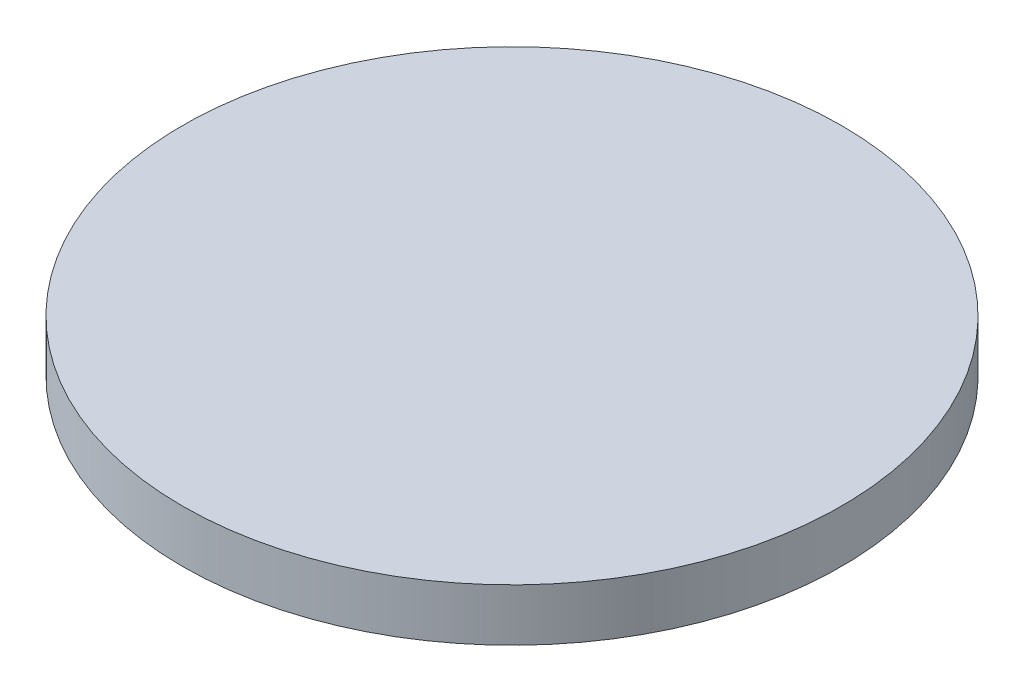
from build123d import *

# Parameters (mm, degrees)
ESQUISSE1_R        = 40
BOSS_EXTRU_1_DEPTH = 6.35


with BuildPart() as part:
    # Esquisse1 → Boss.-Extru.1 (new body)
    with BuildSketch(Plane(origin=(0, 0, 0), x_dir=(1, 0, 0), z_dir=(0, 1, 0))):
        Circle(ESQUISSE1_R)
    extrude(amount=BOSS_EXTRU_1_DEPTH)


solid = part.part
